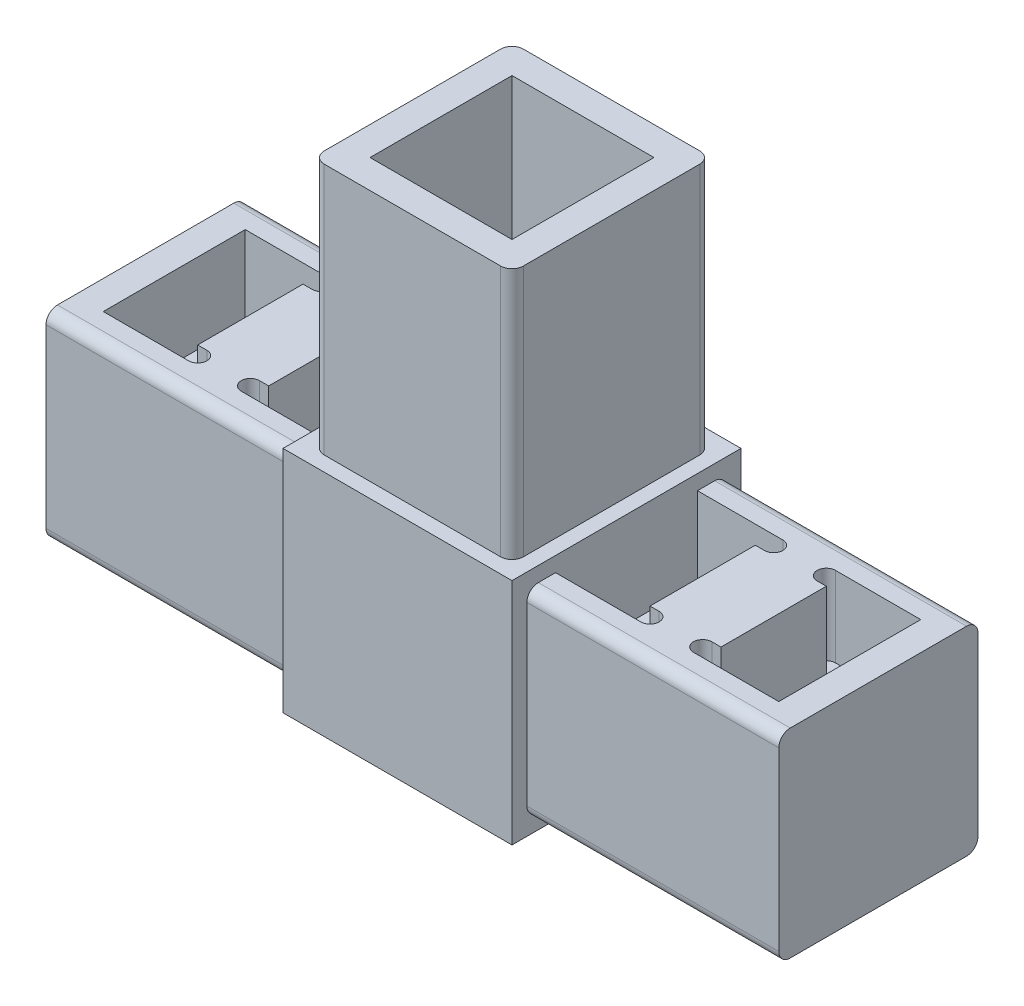
from build123d import *

# Parameters (mm, degrees)
CUT_EXTRUDE1_START       = -25.4
CUT_EXTRUDE1_OUTLINE_W   = 81.28
CUT_EXTRUDE1_OUTLINE_H   = 22.098
CUT_EXTRUDE1_DEPTH       = 23.749
CUT_EXTRUDE1_START_2     = -1.651
CUT_EXTRUDE1_2_OUTLINE_W = 53.34
CUT_EXTRUDE1_2_OUTLINE_H = 22.098
CUT_EXTRUDE1_2_DEPTH     = 1.651
SKETCH2_W                = 27.94
SKETCH2_H                = 22.098
CUT_EXTRUDE2_DEPTH       = 1.651
SKETCH3_W                = 27.94
SKETCH3_H                = 22.098
CUT_EXTRUDE3_DEPTH       = 1.651
SKETCH4_W                = 27.94
SKETCH4_H                = 22.098
CUT_EXTRUDE4_DEPTH       = 1.651
SKETCH5_W                = 25.4
SKETCH5_H                = 25.4
BOSS_EXTRUDE1_DEPTH      = 1.651
SKETCH6_W                = 25.4
SKETCH6_H                = 25.4
BOSS_EXTRUDE2_DEPTH      = 1.651
CUT_EXTRUDE5_DEPTH       = 8.89
CUT_EXTRUDE6_DEPTH       = 8.89
CUT_EXTRUDE7_START       = -8.89
CUT_EXTRUDE7_DEPTH       = 8.89
CUT_EXTRUDE8_START       = -8.89
CUT_EXTRUDE8_DEPTH       = 8.89
CUT_EXTRUDE9_DEPTH       = 8.89
CUT_EXTRUDE10_START      = -8.89
CUT_EXTRUDE10_DEPTH      = 8.89
CUT_EXTRUDE11_DEPTH      = 8.89
CUT_EXTRUDE12_START      = -8.89
CUT_EXTRUDE12_DEPTH      = 8.89
SKETCH15_W               = 22.098
SKETCH15_H               = 22.098
BOSS_EXTRUDE3_DEPTH      = 27.94
SKETCH16_W               = 15.748
SKETCH16_H               = 15.748
CUT_EXTRUDE13_DEPTH      = 27.94
FILLET1_R                = 1.27


with BuildPart() as part:
    # Cut-Extrude1: read off the stored shape, not the designer's step
    # Cut-Extrude1 outline → Cut-Extrude1 (new body)
    with BuildSketch(Plane.XY.offset(12.7).offset(CUT_EXTRUDE1_START)):
        Rectangle(CUT_EXTRUDE1_OUTLINE_W, CUT_EXTRUDE1_OUTLINE_H)
    extrude(amount=CUT_EXTRUDE1_DEPTH)

    # Cut-Extrude1 2 outline → Cut-Extrude1 2 (add)
    with BuildSketch(Plane.XY.offset(12.7).offset(CUT_EXTRUDE1_START_2)):
        with Locations((13.97, 0)):
            Rectangle(CUT_EXTRUDE1_2_OUTLINE_W, CUT_EXTRUDE1_2_OUTLINE_H)
    extrude(amount=CUT_EXTRUDE1_2_DEPTH)

    # Sketch2 → Cut-Extrude2 (cut)
    with BuildSketch(Plane(origin=(0, 0, -12.7), x_dir=(-1, 0, 0), z_dir=(0, 0, -1))):
        with Locations((26.67, 0)):
            Rectangle(SKETCH2_W, SKETCH2_H)
    extrude(amount=-CUT_EXTRUDE2_DEPTH, mode=Mode.SUBTRACT)

    # Sketch3 → Cut-Extrude3 (cut)
    with BuildSketch(Plane(origin=(0, 0, -12.7), x_dir=(-1, 0, 0), z_dir=(0, 0, -1))):
        with Locations((-26.67, 0)):
            Rectangle(SKETCH3_W, SKETCH3_H)
    extrude(amount=-CUT_EXTRUDE3_DEPTH, mode=Mode.SUBTRACT)

    # Sketch4 → Cut-Extrude4 (cut)
    with BuildSketch(Plane.XY.offset(12.7)):
        with Locations((26.67, 0)):
            Rectangle(SKETCH4_W, SKETCH4_H)
    extrude(amount=-CUT_EXTRUDE4_DEPTH, mode=Mode.SUBTRACT)

    # Sketch5 → Boss-Extrude1 (add)
    with BuildSketch(Plane(origin=(0, 11.049, 0), x_dir=(-1, 0, 0), z_dir=(0, 1, 0))):
        Rectangle(SKETCH5_W, SKETCH5_H)
    extrude(amount=BOSS_EXTRUDE1_DEPTH)

    # Sketch6 → Boss-Extrude2 (add)
    with BuildSketch(Plane.XZ.offset(11.049)):
        Rectangle(SKETCH6_W, SKETCH6_H)
    extrude(amount=BOSS_EXTRUDE2_DEPTH)

    # Sketch7 → Cut-Extrude5 (cut)
    with BuildSketch(Plane(origin=(0, 11.049, 0), x_dir=(-1, 0, 0), z_dir=(0, 1, 0))):
        with BuildLine():
            Line((-12.7, -7.874), (-12.7, 7.874))
            Line((-12.7, 7.874), (-22.1615, 7.874))
            ThreePointArc((-22.1615, 7.874), (-23.1775, 6.858), (-22.1615, 5.842))
            Line((-22.1615, 5.842), (-21.1455, 5.842))
            Line((-21.1455, 5.842), (-21.1455, -5.842))
            Line((-21.1455, -5.842), (-22.1615, -5.842))
            ThreePointArc((-22.1615, -5.842), (-23.1775, -6.858), (-22.1615, -7.874))
            Line((-22.1615, -7.874), (-12.7, -7.874))
        make_face()
    extrude(amount=-CUT_EXTRUDE5_DEPTH, mode=Mode.SUBTRACT)

    # Sketch8 → Cut-Extrude6 (cut)
    with BuildSketch(Plane.XZ.offset(11.049)):
        with BuildLine():
            Line((-22.1615, 5.842), (-21.1455, 5.842))
            Line((-21.1455, 5.842), (-21.1455, -5.842))
            Line((-21.1455, -5.842), (-22.1615, -5.842))
            ThreePointArc((-22.1615, -5.842), (-23.1775, -6.858), (-22.1615, -7.874))
            Line((-22.1615, -7.874), (-12.7, -7.874))
            Line((-12.7, -7.874), (-12.7, 7.874))
            Line((-12.7, 7.874), (-22.1615, 7.874))
            ThreePointArc((-22.1615, 7.874), (-23.1775, 6.858), (-22.1615, 5.842))
        make_face()
    extrude(amount=-CUT_EXTRUDE6_DEPTH, mode=Mode.SUBTRACT)

    # Sketch9 → Cut-Extrude7 (cut)
    with BuildSketch(Plane.XZ.offset(11.049).offset(CUT_EXTRUDE7_START)):
        with BuildLine():
            Line((12.7, 7.874), (12.7, -7.874))
            Line((12.7, -7.874), (22.1615, -7.874))
            ThreePointArc((22.1615, -7.874), (23.1775, -6.858), (22.1615, -5.842))
            Line((22.1615, -5.842), (21.1455, -5.842))
            Line((21.1455, -5.842), (21.1455, 5.842))
            Line((21.1455, 5.842), (22.1615, 5.842))
            ThreePointArc((22.1615, 5.842), (23.1775, 6.858), (22.1615, 7.874))
            Line((22.1615, 7.874), (12.7, 7.874))
        make_face()
    extrude(amount=CUT_EXTRUDE7_DEPTH, mode=Mode.SUBTRACT)

    # Sketch10 → Cut-Extrude8 (cut)
    with BuildSketch(Plane(origin=(0, 11.049, 0), x_dir=(-1, 0, 0), z_dir=(0, 1, 0)).offset(CUT_EXTRUDE8_START)):
        with BuildLine():
            Line((21.1455, 5.842), (22.1615, 5.842))
            ThreePointArc((22.1615, 5.842), (23.1775, 6.858), (22.1615, 7.874))
            Line((22.1615, 7.874), (12.7, 7.874))
            Line((12.7, 7.874), (12.7, -7.874))
            Line((12.7, -7.874), (22.1615, -7.874))
            ThreePointArc((22.1615, -7.874), (23.1775, -6.858), (22.1615, -5.842))
            Line((22.1615, -5.842), (21.1455, -5.842))
            Line((21.1455, -5.842), (21.1455, 5.842))
        make_face()
    extrude(amount=CUT_EXTRUDE8_DEPTH, mode=Mode.SUBTRACT)

    # Sketch11 → Cut-Extrude9 (cut)
    with BuildSketch(Plane.XZ.offset(11.049)):
        with BuildLine():
            Line((28.0035, 5.842), (29.0195, 5.842))
            Line((29.0195, 5.842), (29.0195, -5.842))
            Line((29.0195, -5.842), (28.0035, -5.842))
            ThreePointArc((28.0035, -5.842), (26.9875, -6.858), (28.0035, -7.874))
            Line((28.0035, -7.874), (37.465, -7.874))
            Line((37.465, -7.874), (37.465, 7.874))
            Line((37.465, 7.874), (28.0035, 7.874))
            ThreePointArc((28.0035, 7.874), (26.9875, 6.858), (28.0035, 5.842))
        make_face()
    extrude(amount=-CUT_EXTRUDE9_DEPTH, mode=Mode.SUBTRACT)

    # Sketch12 → Cut-Extrude10 (cut)
    with BuildSketch(Plane(origin=(0, 11.049, 0), x_dir=(-1, 0, 0), z_dir=(0, 1, 0)).offset(CUT_EXTRUDE10_START)):
        with BuildLine():
            Line((-29.0195, -5.842), (-29.0195, 5.842))
            Line((-29.0195, 5.842), (-28.0035, 5.842))
            ThreePointArc((-28.0035, 5.842), (-26.9875, 6.858), (-28.0035, 7.874))
            Line((-28.0035, 7.874), (-37.465, 7.874))
            Line((-37.465, 7.874), (-37.465, -7.874))
            Line((-37.465, -7.874), (-28.0035, -7.874))
            ThreePointArc((-28.0035, -7.874), (-26.9875, -6.858), (-28.0035, -5.842))
            Line((-28.0035, -5.842), (-29.0195, -5.842))
        make_face()
    extrude(amount=CUT_EXTRUDE10_DEPTH, mode=Mode.SUBTRACT)

    # Sketch13 → Cut-Extrude11 (cut)
    with BuildSketch(Plane(origin=(0, 11.049, 0), x_dir=(-1, 0, 0), z_dir=(0, 1, 0))):
        with BuildLine():
            Line((28.0035, -7.874), (37.465, -7.874))
            Line((37.465, -7.874), (37.465, 7.874))
            Line((37.465, 7.874), (28.0035, 7.874))
            ThreePointArc((28.0035, 7.874), (26.9875, 6.858), (28.0035, 5.842))
            Line((28.0035, 5.842), (29.0195, 5.842))
            Line((29.0195, 5.842), (29.0195, -5.842))
            Line((29.0195, -5.842), (28.0035, -5.842))
            ThreePointArc((28.0035, -5.842), (26.9875, -6.858), (28.0035, -7.874))
        make_face()
    extrude(amount=-CUT_EXTRUDE11_DEPTH, mode=Mode.SUBTRACT)

    # Sketch14 → Cut-Extrude12 (cut)
    with BuildSketch(Plane.XZ.offset(11.049).offset(CUT_EXTRUDE12_START)):
        with BuildLine():
            Line((-37.465, 7.874), (-37.465, -7.874))
            Line((-37.465, -7.874), (-28.0035, -7.874))
            ThreePointArc((-28.0035, -7.874), (-26.9875, -6.858), (-28.0035, -5.842))
            Line((-28.0035, -5.842), (-29.0195, -5.842))
            Line((-29.0195, -5.842), (-29.0195, 5.842))
            Line((-29.0195, 5.842), (-28.0035, 5.842))
            ThreePointArc((-28.0035, 5.842), (-26.9875, 6.858), (-28.0035, 7.874))
            Line((-28.0035, 7.874), (-37.465, 7.874))
        make_face()
    extrude(amount=CUT_EXTRUDE12_DEPTH, mode=Mode.SUBTRACT)

    # Sketch15 → Boss-Extrude3 (add)
    with BuildSketch(Plane(origin=(0, 12.7, 0), x_dir=(-1, 0, 0), z_dir=(0, 1, 0))):
        Rectangle(SKETCH15_W, SKETCH15_H)
    extrude(amount=BOSS_EXTRUDE3_DEPTH)

    # Sketch16 → Cut-Extrude13 (cut)
    with BuildSketch(Plane(origin=(0, 40.64, 0), x_dir=(-1, 0, 0), z_dir=(0, 1, 0))):
        Rectangle(SKETCH16_W, SKETCH16_H)
    extrude(amount=-CUT_EXTRUDE13_DEPTH, mode=Mode.SUBTRACT)

    # Fillet1
    fillet1_edges = [part.edges().sort_by_distance(p)[0] for p in [
        (11.049, 26.67, 11.049),
        (-26.67, 11.049, 11.049),
        (-26.67, -11.049, -11.049),
        (26.67, 11.049, 11.049),
        (11.049, 26.67, -11.049),
        (26.67, 11.049, -11.049),
        (-26.67, -11.049, 11.049),
        (26.67, -11.049, 11.049),
        (-26.67, 11.049, -11.049),
        (-11.049, 26.67, 11.049),
        (26.67, -11.049, -11.049),
        (-11.049, 26.67, -11.049),
    ]]
    fillet(fillet1_edges, radius=FILLET1_R)


solid = part.part
